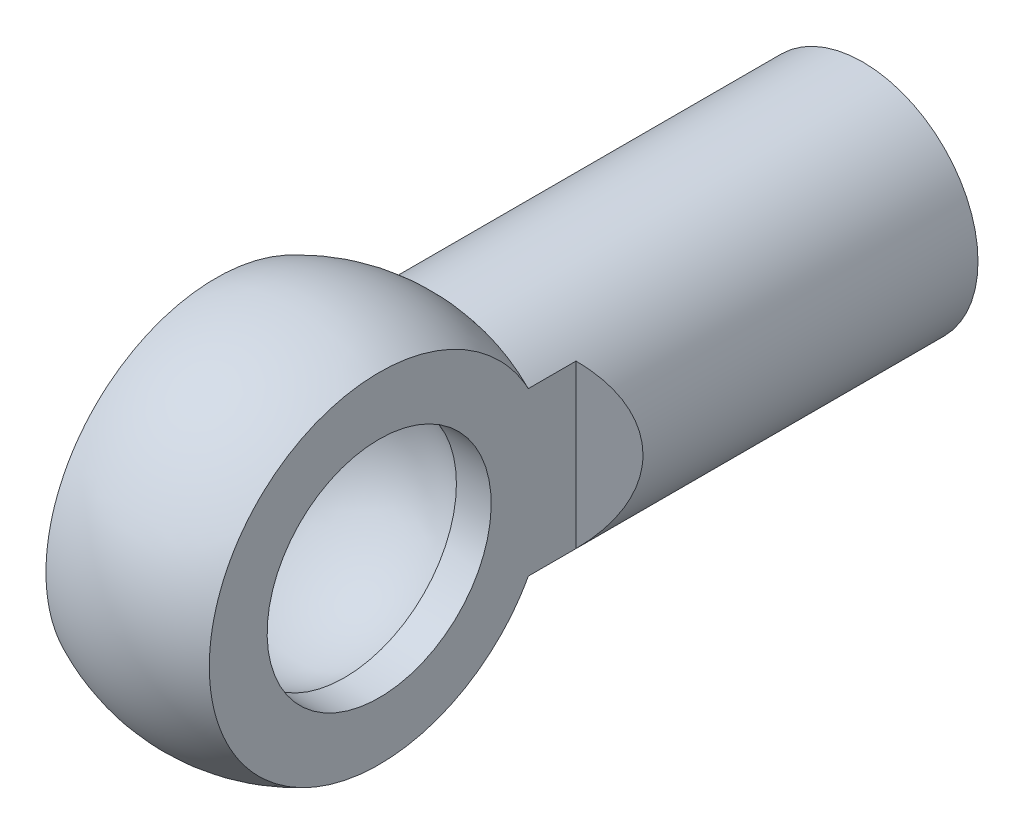
from build123d import *

# Parameters (mm, degrees)
CUT_EXTRUDE_2_DEPTH      = 5.5
CUT_EXTRUDE_2_DEPTH_BACK = 5.5
SKETCH_2_OUTSIDE_W       = 15.41
SKETCH_2_OUTSIDE_H       = 15.41
SKETCH_2_OUTSIDE_W_2     = 3.9
SKETCH_2_OUTSIDE_H_2     = 10
CHAMFER_2_SIZE           = 0.8
CUT_EXTRUDE_START        = -0.830011261
CUT_EXTRUDE_3_OUTLINE_R  = 2.675
CUT_EXTRUDE_3_DEPTH      = 0.830011261


# Read off the part's stored shape, not the designer's step: Вырез-Вытянуть3
with BuildPart() as part:
    # Эскиз1 → Повернуть1 (revolve)
    with BuildSketch(Plane(origin=(0, 0, 0), x_dir=(1, 0, 0), z_dir=(0, 1, 0))):
        with BuildLine():
            ThreePointArc((0, 2.9), (2.9, 0), (0, -2.9))
            Line((0, -2.9), (0, -4.5))
            ThreePointArc((0, -4.5), (4.259036435, -1.452793395), (2.75, 3.561951712))
            Line((2.75, 3.561951712), (2.75, 13.5))
            Line((2.75, 13.5), (1.5, 13.5))
            Line((1.5, 13.5), (1.5, 4.5))
            Line((1.5, 4.5), (0, 4.5))
            Line((0, 4.5), (0, 2.9))
        make_face()
    revolve(axis=Axis((0, 0, 0), (0, 0, -1)))

    # Эскиз2 outside → Вырез-Вытянуть2 (cut, two sides: drawn at the far end of the back side and taken through both)
    with BuildSketch(Plane.XY.offset(-CUT_EXTRUDE_2_DEPTH_BACK)):
        Rectangle(SKETCH_2_OUTSIDE_W, SKETCH_2_OUTSIDE_H)
        Rectangle(SKETCH_2_OUTSIDE_W_2, SKETCH_2_OUTSIDE_H_2, mode=Mode.SUBTRACT)
    extrude(amount=CUT_EXTRUDE_2_DEPTH + CUT_EXTRUDE_2_DEPTH_BACK, mode=Mode.SUBTRACT)

    # Фаска2
    chamfer_2_edges = [part.edges().sort_by_distance(p)[0] for p in [
        (1.95, 0, -5.5),
        (-1.95, 0, -5.5),
    ]]
    chamfer(chamfer_2_edges, length=CHAMFER_2_SIZE - 0.0001)  # a hair under: the kernel refuses the full size

    # Вырез-Вытянуть3 outline → Вырез-Вытянуть3 (cut)
    with BuildSketch(Plane(origin=(1.95, 0, 0), x_dir=(0, 0, -1), z_dir=(1, 0, 0)).offset(CUT_EXTRUDE_START)):
        Circle(CUT_EXTRUDE_3_OUTLINE_R)
    extrude(amount=CUT_EXTRUDE_3_DEPTH, mode=Mode.SUBTRACT)


solid = part.part
